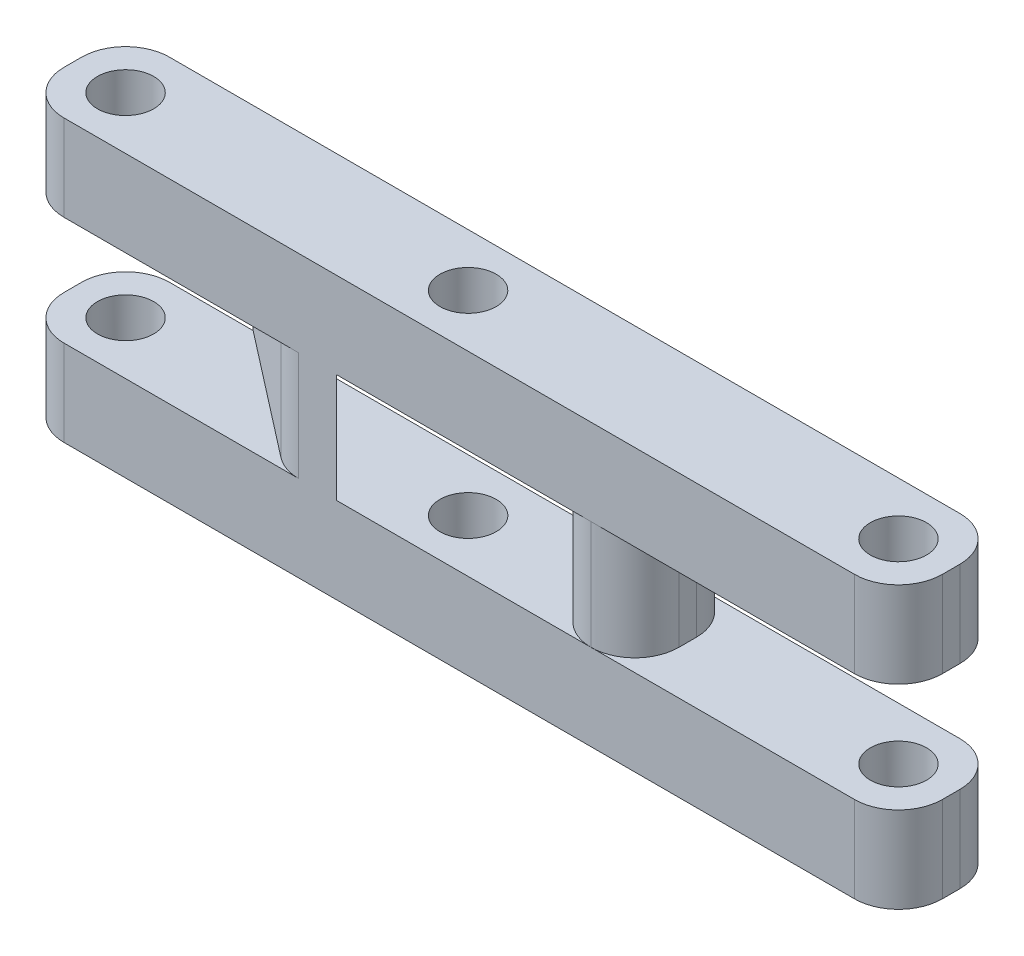
from build123d import *

# Parameters (mm, degrees)
SKETCH1_W               = 50
SKETCH1_H               = 6
BOSS_EXTRUDE1_DEPTH     = 8
SKETCH2_W               = 15
SKETCH2_H               = 6
CUT_EXTRUDE1_DEPTH      = 3.1
CUT_EXTRUDE2_DEPTH      = 27.419689627
CUT_EXTRUDE2_DEPTH_BACK = 27.419689627
SKETCH3_R               = 1.6
FILLET1_R               = 2.5


with BuildPart() as part:
    # Sketch1 → Boss-Extrude1 (new, symmetric)
    with BuildSketch(Plane(origin=(0, 0, 0), x_dir=(1, 0, 0), z_dir=(0, 1, 0))):
        Rectangle(SKETCH1_W, SKETCH1_H)
    extrude(amount=BOSS_EXTRUDE1_DEPTH, both=True)

    # Sketch2 → Cut-Extrude1 (cut, symmetric)
    with BuildSketch(Plane(origin=(0, 0, 0), x_dir=(1, 0, 0), z_dir=(0, 1, 0))):
        Polygon((-25, -3), (-10, -3), (-17.736081979, 3), (-25, 3), align=None)
        with Locations((17.5, 0)):
            Rectangle(SKETCH2_W, SKETCH2_H)
        Polygon((5, 3), (-14.736081979, 3), (-7, -3), (5, -3), align=None)
    extrude(amount=CUT_EXTRUDE1_DEPTH, both=True, mode=Mode.SUBTRACT)

    # Sketch3 → Cut-Extrude2 (cut, two sides: drawn at the far end of the back side and taken through both)
    with BuildSketch(Plane(origin=(0, 0, 0), x_dir=(1, 0, 0), z_dir=(0, 1, 0)).offset(-CUT_EXTRUDE2_DEPTH_BACK)):
        with Locations(Location((-22, 0, 0), (0, 0, 270))):
            Circle(SKETCH3_R)
        with Locations(Location((22, 0, 0), (0, 0, 270))):
            Circle(SKETCH3_R)
        with Locations(Location((-2.5, 0, 0), (0, 0, 270))):
            Circle(SKETCH3_R)
    extrude(amount=CUT_EXTRUDE2_DEPTH + CUT_EXTRUDE2_DEPTH_BACK, mode=Mode.SUBTRACT)

    # Fillet1
    fillet1_edges = [part.edges().sort_by_distance(p)[0] for p in [
        (25, -5.55, 3),
        (-25, -5.55, 3),
        (-25, -5.55, -3),
        (25, -5.55, -3),
        (5, 0, -3),
        (5, 0, 3),
        (-14.736081979, 0, -3),
        (10, 0, 3),
        (10, 0, -3),
        (-10, 0, 3),
        (25, 5.55, 3),
        (-25, 5.55, 3),
        (-25, 5.55, -3),
        (25, 5.55, -3),
    ]]
    fillet(fillet1_edges, radius=FILLET1_R - 0.0001)  # a hair under: the kernel refuses the full size


solid = part.part
